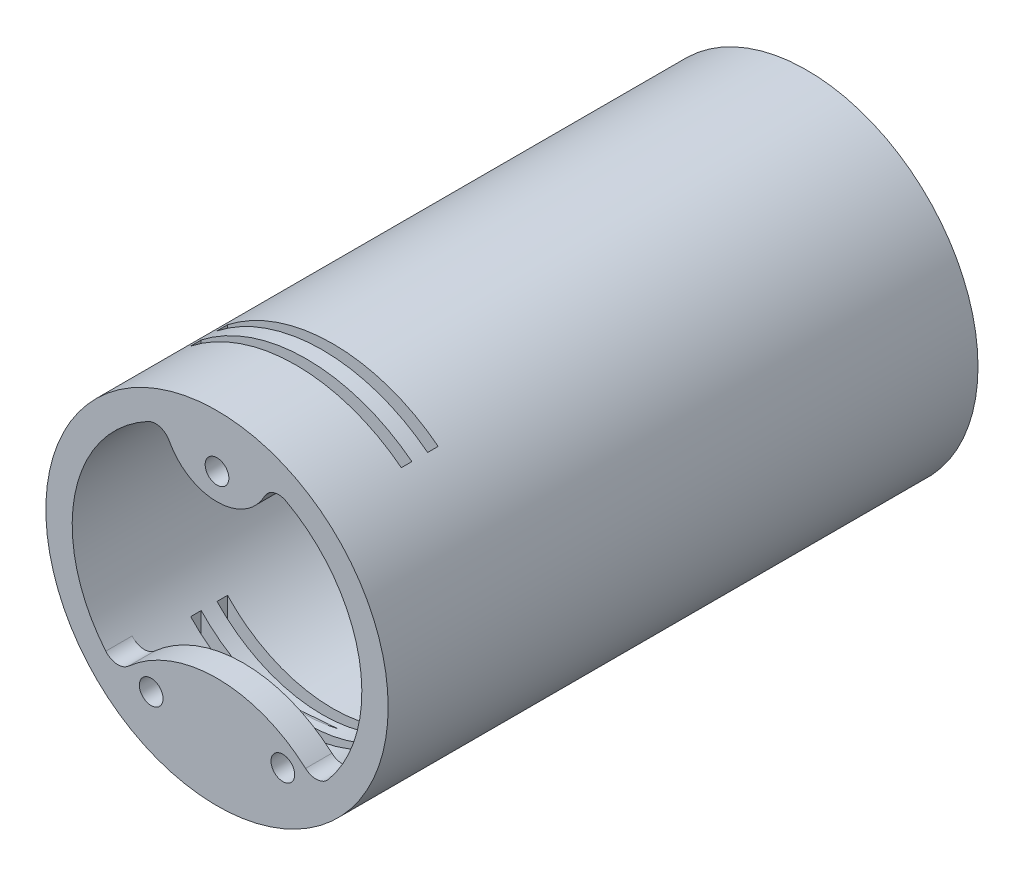
from build123d import *

# Parameters (mm, degrees)
CROQUIS1_R          = 32.5
CROQUIS1_R_2        = 27.5
BOSS_EXTRUDE1_DEPTH = 112
SKETCH1_R           = 1.5
CUT_EXTRUDE1_DEPTH  = 5
BOSS_EXTRUDE4_START = -5
BOSS_EXTRUDE4_DEPTH = 5
SKETCH2_R           = 2.25
CUT_EXTRUDE2_DEPTH  = 5
FILLET1_R           = 3
SKETCH5_W           = 40
SKETCH5_H           = 2
CUT_EXTRUDE3_DEPTH  = 35


with BuildPart() as part:
    # Croquis1 → Boss-Extrude1 (new body)
    with BuildSketch(Plane.XY):
        Circle(CROQUIS1_R)
        Circle(CROQUIS1_R_2, mode=Mode.SUBTRACT)
    extrude(amount=BOSS_EXTRUDE1_DEPTH)

    # Sketch1 → Cut-Extrude1 (cut)
    with BuildSketch(Plane(origin=(0, 0, 0), x_dir=(-1, 0, 0), z_dir=(0, 0, -1))):
        with Locations((-30, 0)):
            Circle(SKETCH1_R)
        with Locations((0, 30)):
            Circle(SKETCH1_R)
        with Locations((30, 0)):
            Circle(SKETCH1_R)
        with Locations((0, -30)):
            Circle(SKETCH1_R)
    extrude(amount=-CUT_EXTRUDE1_DEPTH, mode=Mode.SUBTRACT)

    # Sketch4 → Boss-Extrude4 (add)
    with BuildSketch(Plane.XY.offset(112).offset(BOSS_EXTRUDE4_START)):
        with BuildLine():
            ThreePointArc((-10, 25.617376915), (0, 17.5), (10, 25.617376915))
            ThreePointArc((10, 25.617376915), (0, 27.5), (-10, 25.617376915))
        make_face()
        with BuildLine():
            ThreePointArc((-18.874586088, -20), (0, -11.5), (18.874586088, -20))
            ThreePointArc((18.874586088, -20), (0, -27.5), (-18.874586088, -20))
        make_face()
    extrude(amount=BOSS_EXTRUDE4_DEPTH)

    # Sketch2 → Cut-Extrude2 (cut)
    with BuildSketch(Plane.XY.offset(112)):
        with Locations((-12.5, -20)):
            Circle(SKETCH2_R)
        with Locations((12.5, -20)):
            Circle(SKETCH2_R)
        with Locations((0, 22.5)):
            Circle(SKETCH2_R)
    extrude(amount=-CUT_EXTRUDE2_DEPTH, mode=Mode.SUBTRACT)

    # Fillet1
    fillet1_edges = [part.edges().sort_by_distance(p)[0] for p in [
        (18.874586088, -20, 109.5),
        (-18.874586088, -20, 109.5),
        (10, 25.617376915, 109.5),
        (-10, 25.617376915, 109.5),
    ]]
    fillet(fillet1_edges, radius=FILLET1_R)

    # Sketch5 → Cut-Extrude3 (cut, symmetric)
    with BuildSketch(Plane(origin=(0, 0, 0), x_dir=(1, 0, 0), z_dir=(0, 1, 0))):
        with Locations((0, -96)):
            Rectangle(SKETCH5_W, SKETCH5_H)
        with Locations((0, -91)):
            Rectangle(SKETCH5_W, SKETCH5_H)
    extrude(amount=CUT_EXTRUDE3_DEPTH, both=True, mode=Mode.SUBTRACT)


solid = part.part
